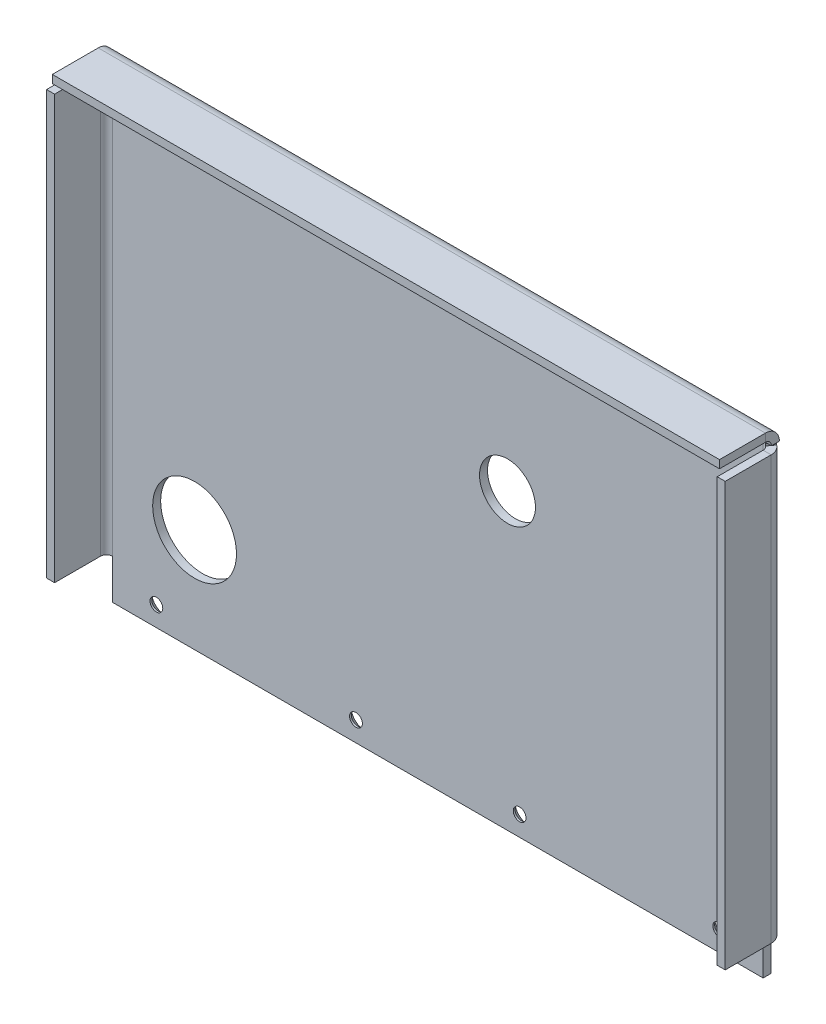
from build123d import *

# Parameters (mm, degrees)
SKETCH1_W                                       = 170
SKETCH1_H                                       = 118
BOSS_EXTRUDE1_DEPTH                             = 2
EDGE_FLANGE4_STRIP_W                            = 11
EDGE_FLANGE4_STRIP_H                            = 2
EDGE_FLANGE4_STRIP_CUT_DEPTH                    = 170
EDGE_FLANGE4_DEPTH                              = 170
EDGE_FLANGE5_STRIP_W                            = 11
EDGE_FLANGE5_STRIP_H                            = 2
EDGE_FLANGE5_STRIP_CUT_DEPTH                    = 116.5
EDGE_FLANGE5_DEPTH                              = 116.5
EDGE_FLANGE6_STRIP_W                            = 11
EDGE_FLANGE6_STRIP_H                            = 2
EDGE_FLANGE6_STRIP_CUT_DEPTH                    = 116.5
EDGE_FLANGE6_DEPTH                              = 116.5
SKETCH26_W                                      = 18.240462441
SKETCH26_H                                      = 10
CUT_EXTRUDE2_DEPTH                              = 3.5
SKETCH27_W                                      = 23.960032842
SKETCH27_H                                      = 10
CUT_EXTRUDE3_DEPTH                              = 3.5
CSK_FOR_M3_FLAT_HEAD_MACHINE_SCREW2_D           = 3.2
CSK_FOR_M3_FLAT_HEAD_MACHINE_SCREW2_CSINK_D     = 6.3
CSK_FOR_M3_FLAT_HEAD_MACHINE_SCREW2_CSINK_ANGLE = 90
CUT_EXTRUDE4_REACH                              = 125.324
SKETCH32_R                                      = 7
CUT_EXTRUDE5_REACH                              = 125.324
SKETCH33_R                                      = 10.5
CUT_EXTRUDE6_START                              = -4
CUT_EXTRUDE6_OUTLINE_W                          = 1.43
CUT_EXTRUDE6_OUTLINE_H                          = 18
CUT_EXTRUDE6_OUTLINE_W_2                        = 1.43354479
CUT_EXTRUDE6_DEPTH                              = 4
CUT_EXTRUDE6_2_DEPTH                            = 0.5


# Read off the part's stored shape, not the designer's step: Cut-Extrude6
# Sheet-metal steps are written as plain solids
with BuildPart() as part:
    # Sketch1 → Boss-Extrude1 (new body)
    with BuildSketch(Plane.XY):
        with Locations((2.219863014, -26.886363636)):
            Rectangle(SKETCH1_W, SKETCH1_H)
    extrude(amount=BOSS_EXTRUDE1_DEPTH)

    # Edge-Flange4 strip (across the edge) → Edge-Flange4 strip cut (cut)
    with BuildSketch(Plane(origin=(87.219863014, 32.113636364, 2), x_dir=(0, -1, 0), z_dir=(-1, 0, 0))):
        with Locations((-4, -1)):
            Rectangle(EDGE_FLANGE4_STRIP_W, EDGE_FLANGE4_STRIP_H)
    extrude(amount=EDGE_FLANGE4_STRIP_CUT_DEPTH, mode=Mode.SUBTRACT)

    # Edge-Flange4 section (across the edge) → Edge-Flange4 (add)
    with BuildSketch(Plane(origin=(87.219863014, 32.113636364, 2), x_dir=(0, -1, 0), z_dir=(-1, 0, 0))):
        with BuildLine():
            Line((-2, 1.5), (-2, 13))
            Line((-2, 13), (0, 13))
            Line((0, 13), (0, 1.5))
            ThreePointArc((0, 1.5), (0.439339828, 0.439339828), (1.5, 0))
            Line((1.5, 0), (1.5, -2))
            ThreePointArc((1.5, -2), (-0.974873734, -0.974873734), (-2, 1.5))
        make_face()
    extrude(amount=EDGE_FLANGE4_DEPTH)

    # Edge-Flange5 strip (across the edge) → Edge-Flange5 strip cut (cut)
    with BuildSketch(Plane(origin=(-82.780136986, 30.613636364, 2), x_dir=(1, 0, 0), z_dir=(0, -1, 0))):
        with Locations((-2, -1)):
            Rectangle(EDGE_FLANGE5_STRIP_W, EDGE_FLANGE5_STRIP_H)
    extrude(amount=EDGE_FLANGE5_STRIP_CUT_DEPTH, mode=Mode.SUBTRACT)

    # Edge-Flange5 section (across the edge) → Edge-Flange5 (add)
    with BuildSketch(Plane(origin=(-82.780136986, 30.613636364, 2), x_dir=(1, 0, 0), z_dir=(0, -1, 0))):
        with BuildLine():
            Line((0, 1.5), (0, 13))
            Line((0, 13), (2, 13))
            Line((2, 13), (2, 1.5))
            ThreePointArc((2, 1.5), (2.439339828, 0.439339828), (3.5, 0))
            Line((3.5, 0), (3.5, -2))
            ThreePointArc((3.5, -2), (1.025126266, -0.974873734), (0, 1.5))
        make_face()
    extrude(amount=EDGE_FLANGE5_DEPTH)

    # Edge-Flange6 strip (across the edge) → Edge-Flange6 strip cut (cut)
    with BuildSketch(Plane(origin=(87.219863014, -85.886363636, 2), x_dir=(-1, 0, 0), z_dir=(0, 1, 0))):
        with Locations((-2, -1)):
            Rectangle(EDGE_FLANGE6_STRIP_W, EDGE_FLANGE6_STRIP_H)
    extrude(amount=EDGE_FLANGE6_STRIP_CUT_DEPTH, mode=Mode.SUBTRACT)

    # Edge-Flange6 section (across the edge) → Edge-Flange6 (add)
    with BuildSketch(Plane(origin=(87.219863014, -85.886363636, 2), x_dir=(-1, 0, 0), z_dir=(0, 1, 0))):
        with BuildLine():
            Line((0, 1.5), (0, 13))
            Line((0, 13), (2, 13))
            Line((2, 13), (2, 1.5))
            ThreePointArc((2, 1.5), (2.439339828, 0.439339828), (3.5, 0))
            Line((3.5, 0), (3.5, -2))
            ThreePointArc((3.5, -2), (1.025126266, -0.974873734), (0, 1.5))
        make_face()
    extrude(amount=EDGE_FLANGE6_DEPTH)

    # Sketch26 → Cut-Extrude2 (cut)
    with BuildSketch(Plane.ZY.offset(82.780136986)):
        with Locations((5.87976878, -80.886363636)):
            Rectangle(SKETCH26_W, SKETCH26_H)
    extrude(amount=-CUT_EXTRUDE2_DEPTH, mode=Mode.SUBTRACT)

    # Sketch27 → Cut-Extrude3 (cut)
    with BuildSketch(Plane(origin=(87.219863014, 0, 0), x_dir=(0, 0, -1), z_dir=(1, 0, 0))):
        with Locations((-3.019983579, -80.886363636)):
            Rectangle(SKETCH27_W, SKETCH27_H)
    extrude(amount=-CUT_EXTRUDE3_DEPTH, mode=Mode.SUBTRACT)

    # CSK for M3 Flat Head Machine Screw2 (through all)
    with Locations(Plane(origin=(0, 0, 0), x_dir=(-1, 0, 0), z_dir=(0, 0, -1))):
        with Locations((-72.719863014, -80.886363636), (-22.719863014, -80.886363636), (18.280136986, -80.886363636), (68.280136986, -80.886363636)):
            CounterSinkHole(CSK_FOR_M3_FLAT_HEAD_MACHINE_SCREW2_D / 2, CSK_FOR_M3_FLAT_HEAD_MACHINE_SCREW2_CSINK_D / 2, counter_sink_angle=CSK_FOR_M3_FLAT_HEAD_MACHINE_SCREW2_CSINK_ANGLE)

    # Sketch32 → Cut-Extrude4 (cut, up to next)
    with BuildSketch(Plane(origin=(0, 0, 0), x_dir=(-1, 0, 0), z_dir=(0, 0, -1)), mode=Mode.PRIVATE) as cut_extrude4_sk1:
        with Locations((-19.678120583, -12.276718373)):
            Circle(SKETCH32_R)
    cut_extrude4_tool1 = extrude(cut_extrude4_sk1.sketch, amount=-CUT_EXTRUDE4_REACH, mode=Mode.PRIVATE) & part.part
    add(cut_extrude4_tool1.solids().sort_by_distance((19.678121, -12.276718, 0))[0], mode=Mode.SUBTRACT)

    # Sketch33 → Cut-Extrude5 (cut, up to next)
    with BuildSketch(Plane(origin=(0, 0, 0), x_dir=(-1, 0, 0), z_dir=(0, 0, -1)), mode=Mode.PRIVATE) as cut_extrude5_sk1:
        with Locations((58.713568672, -59.876553933)):
            Circle(SKETCH33_R)
    cut_extrude5_tool1 = extrude(cut_extrude5_sk1.sketch, amount=-CUT_EXTRUDE5_REACH, mode=Mode.PRIVATE) & part.part
    add(cut_extrude5_tool1.solids().sort_by_distance((-58.713569, -59.876554, 0))[0], mode=Mode.SUBTRACT)

    # Cut-Extrude6 outline → Cut-Extrude6 (cut)
    with BuildSketch(Plane(origin=(0, 34.113636364, 0), x_dir=(1, 0, 0), z_dir=(0, 1, 0)).offset(CUT_EXTRUDE6_START)):
        with Locations((86.504863014, -8)):
            Rectangle(CUT_EXTRUDE6_OUTLINE_W, CUT_EXTRUDE6_OUTLINE_H)
        with Locations((-82.063364591, -8)):
            Rectangle(CUT_EXTRUDE6_OUTLINE_W_2, CUT_EXTRUDE6_OUTLINE_H)
    extrude(amount=CUT_EXTRUDE6_DEPTH, mode=Mode.SUBTRACT)

    # Cut-Extrude6 2 outline → Cut-Extrude6 2 (cut)
    with BuildSketch(Plane(origin=(0, 34.113636364, 0), x_dir=(1, 0, 0), z_dir=(0, 1, 0)).offset(CUT_EXTRUDE6_START)):
        Polygon((85.789863014, -17), (85.789863014, -0.677749125), (84.607005871, -2.290463911), (73.818191888, -17), align=None)
        Polygon((-81.346592196, -17), (-69.404507856, -17), (-80.165760648, -2.289351112), (-81.346592196, -0.675152595), align=None)
    extrude(amount=CUT_EXTRUDE6_2_DEPTH, mode=Mode.SUBTRACT)


solid = part.part
